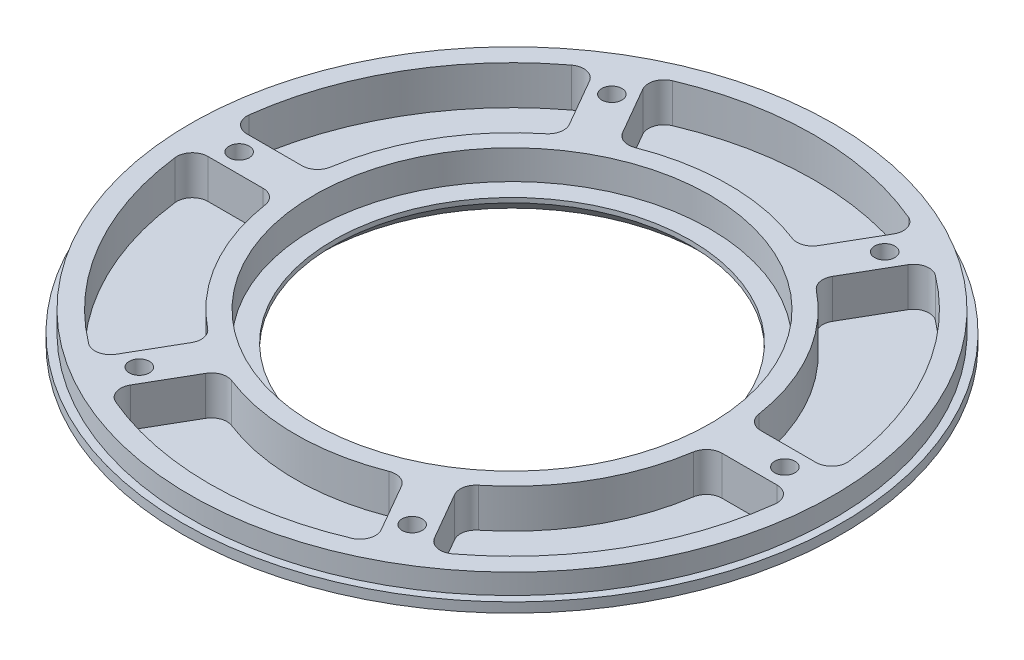
from build123d import *

# Parameters (mm, degrees)
F_6_0_204_DIAMETER_HOLE1_D = 5.1816
CIRPATTERN3_COUNT          = 6
CUT_EXTRUDE1_DEPTH         = 10
FILLET1_R                  = 4
CIRPATTERN4_COUNT          = 6
FILLET1_OF_CIRPATTERN4_R   = 4
CHAMFER1_SIZE              = 4
BOSS_EXTRUDE1_START        = -7.5
SKETCH10_R                 = 84.55
SKETCH10_R_2               = 82.54999999999998
BOSS_EXTRUDE1_DEPTH        = 7.5
CHAMFER3_SIZE              = 5
CHAMFER3_SIZE2             = 8.660254037844433
FILLET4_R                  = 5


with BuildPart() as part:
    # Sketch2 → Revolve1 (revolve)
    with BuildSketch(Plane(origin=(0, 0, 0), x_dir=(0, 0, -1), z_dir=(1, 0, 0))):
        Polygon((-45.8, 1e-16), (-82.55, -4.08e-15), (-82.55, 12.699999999999996), (-50.8, 12.699999999999994), (-50.8, 5.199999999999995), (-45.8, 5.199999999999997), align=None)
    revolve(axis=Axis((0, -0.500000000000003, 0), (0, 1, 0)))

    # #6 (0.204) Diameter Hole1 (through all)
    with Locations(Plane(origin=(0, 12.699999999999996, 0), x_dir=(1, 0, 0), z_dir=(0, 1, 0))):
        with Locations((-35, 60.621778265)):
            f_6_0_204_diameter_hole1 = Hole(F_6_0_204_DIAMETER_HOLE1_D / 2)

    # CirPattern3: #6 (0.204) Diameter Hole1 ×6 about axis
    cirpattern3_axis = Axis((0, -0.500000000000003, 0), (0, 1, 0))
    for i in range(1, CIRPATTERN3_COUNT):
        add(f_6_0_204_diameter_hole1.rotate(cirpattern3_axis, i * 360 / CIRPATTERN3_COUNT), mode=Mode.SUBTRACT)

    # Sketch8 → Cut-Extrude1 (cut)
    with BuildSketch(Plane(origin=(0, 12.699999999999996, 0), x_dir=(1, 0, 0), z_dir=(0, 1, 0))):
        with BuildLine():
            Line((-23.332132921292448, 50.41243966862883), (-34.36419588509058, 69.52053323422602))
            ThreePointArc((-34.36419588509058, 69.52053323422602), (4.75e-15, 77.55000000000001), (34.36419588509058, 69.52053323422602))
            Line((34.36419588509058, 69.52053323422602), (23.332132921292448, 50.41243966862883))
            ThreePointArc((23.332132921292448, 50.41243966862883), (3.4e-15, 55.550000000000004), (-23.332132921292448, 50.41243966862883))
        make_face()
    cut_extrude1 = extrude(amount=-CUT_EXTRUDE1_DEPTH, mode=Mode.SUBTRACT)

    # Fillet1
    fillet1_edges = [part.edges().sort_by_distance(p)[0] for p in [
        (-23.332132921292445, 7.699999999999996, -50.412439668628835),
        (23.332132921292448, 7.699999999999996, -50.41243966862883),
        (34.36419588509058, 7.699999999999996, -69.52053323422604),
        (-34.36419588509058, 7.699999999999996, -69.52053323422604),
    ]]
    fillet(fillet1_edges, radius=FILLET1_R)

    # CirPattern4: Cut-Extrude1 ×6 about axis
    cirpattern4_axis = Axis((0, -0.500000000000003, 0), (0, 1, 0))
    for i in range(1, CIRPATTERN4_COUNT):
        add(cut_extrude1.rotate(cirpattern4_axis, i * 360 / CIRPATTERN4_COUNT), mode=Mode.SUBTRACT)

    # Fillet1 of CirPattern4
    fillet1_of_cirpattern4_edges = [part.edges().sort_by_distance(p)[0] for p in [
        (-55.324519880429165, 7.699999999999996, -4.999999999999943),
        (-31.992386959136702, 7.699999999999996, -45.412439668628906),
        (-43.02444992293479, 7.699999999999996, -64.52053323422614),
        (-77.38864580802537, 7.699999999999996, -4.999999999999911),
        (-31.992386959136727, 7.699999999999996, 45.41243966862889),
        (-55.32451988042916, 7.699999999999996, 4.999999999999915),
        (-77.38864580802539, 7.699999999999996, 4.999999999999886),
        (-43.024449922934814, 7.699999999999996, 64.52053323422612),
        (23.332132921292438, 7.699999999999996, 50.412439668628835),
        (-23.332132921292455, 7.699999999999996, 50.41243966862883),
        (-34.36419588509059, 7.699999999999996, 69.52053323422604),
        (34.364195885090574, 7.699999999999996, 69.52053323422604),
        (55.32451988042916, 7.699999999999996, 4.999999999999961),
        (31.992386959136688, 7.699999999999996, 45.41243966862892),
        (43.024449922934764, 7.699999999999996, 64.52053323422615),
        (77.38864580802537, 7.699999999999996, 4.99999999999994),
        (31.992386959136713, 7.699999999999996, -45.412439668628906),
        (55.32451988042916, 7.699999999999996, -4.999999999999936),
        (77.38864580802537, 7.699999999999996, -4.999999999999911),
        (43.02444992293479, 7.699999999999996, -64.52053323422614),
    ]]
    fillet(fillet1_of_cirpattern4_edges, radius=FILLET1_OF_CIRPATTERN4_R)

    # Chamfer1
    chamfer1_edges = [part.edges().sort_by_distance(p)[0] for p in [
        (5.61e-15, 1.1e-16, -45.8),
    ]]
    chamfer(chamfer1_edges, length=CHAMFER1_SIZE)

    # Sketch10 → Boss-Extrude1 (add)
    with BuildSketch(Plane.XZ.offset(BOSS_EXTRUDE1_START)):
        Circle(SKETCH10_R)
        Circle(SKETCH10_R_2, mode=Mode.SUBTRACT)
    extrude(amount=BOSS_EXTRUDE1_DEPTH)

    # Chamfer3
    chamfer3_edges = [part.edges().sort_by_distance(p)[0] for p in [
        (-84.55, 0, 1.035e-14),
    ]]
    chamfer3_side = [part.faces().sort_by_distance(p)[0] for p in [
        (-84.55, 3.75, 1.035e-14),
    ]]
    chamfer(chamfer3_edges, length=CHAMFER3_SIZE, length2=CHAMFER3_SIZE2, reference=chamfer3_side[0])

    # Fillet4
    fillet4_edges = [part.edges().sort_by_distance(p)[0] for p in [
        (-75.88974596215556, 1.1e-16, 9.29e-15),
    ]]
    fillet(fillet4_edges, radius=FILLET4_R)


solid = part.part
